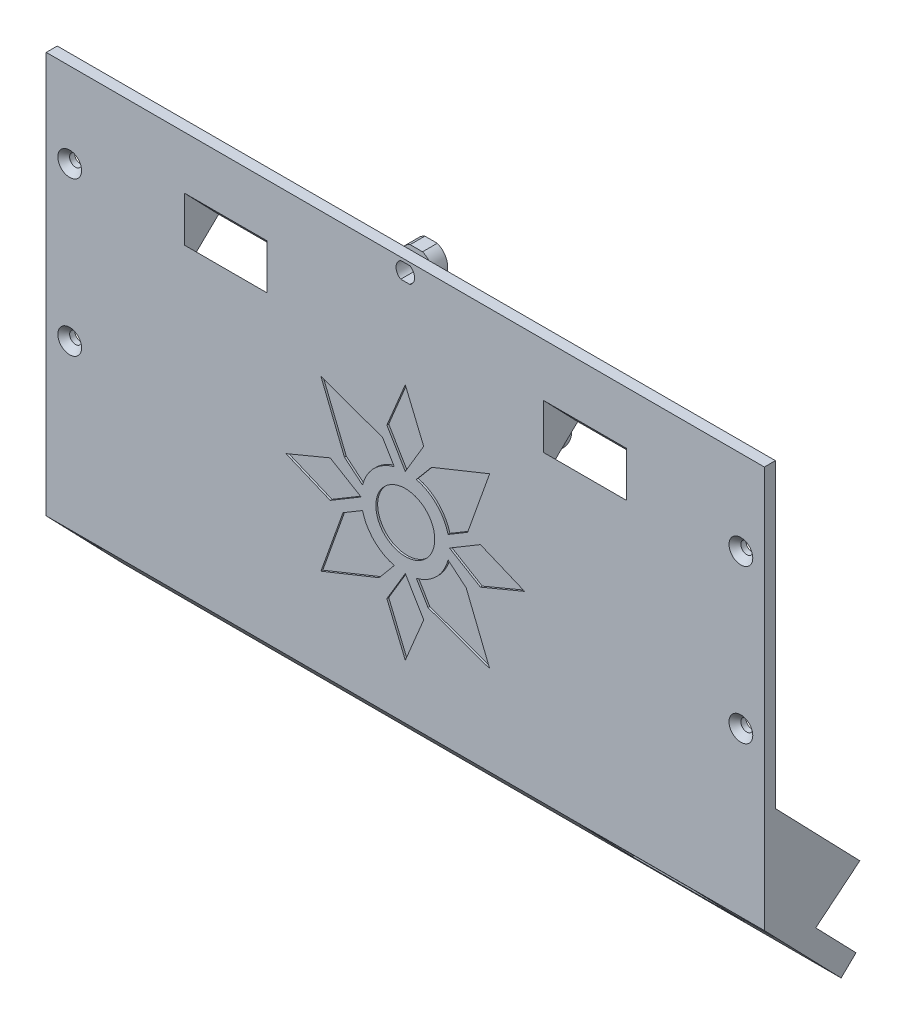
from build123d import *

# Parameters (mm, degrees)
CROQUIS1_W                  = 195
CROQUIS1_H                  = 38
CROQUIS1_R                  = 1.625
SALIENTE_EXTRUIR1_DEPTH     = 3
CROQUIS8_W                  = 195
CROQUIS8_H                  = 3
SALIENTE_EXTRUIR5_DEPTH     = 5
CROQUIS9_W                  = 195
CROQUIS9_H                  = 3
SALIENTE_EXTRUIR6_DEPTH     = 5
SALIENTE_EXTRUIR7_START     = -35
SALIENTE_EXTRUIR7_DEPTH     = 35
CORTAR_EXTRUIR4_DEPTH       = 106.247150057
CORTAR_EXTRUIR4_DEPTH_BACK  = 106.247150057
CROQUIS11_W                 = 22.5
CROQUIS11_H                 = 8.5
CORTAR_EXTRUIR5_REACH       = 168.011
CROQUIS13_R                 = 1
CORTAR_EXTRUIR6_DEPTH       = 5
SALIENTE_EXTRUIR8_START     = -35
SALIENTE_EXTRUIR8_DEPTH     = 35
CORTAR_EXTRUIR7_DEPTH       = 105.093743192
CORTAR_EXTRUIR7_DEPTH_BACK  = 105.093743192
CROQUIS16_W                 = 22.5
CROQUIS16_H                 = 8.5
CROQUIS17_R                 = 1
CORTAR_EXTRUIR8_DEPTH       = 5
CROQUIS18_R                 = 1.625
CORTAR_EXTRUIR9_DEPTH       = 10
CROQUIS19_W                 = 195
CROQUIS19_H                 = 24
SALIENTE_EXTRUIR9_DEPTH     = 3
CROQUIS20_W                 = 195
CROQUIS20_H                 = 28.69
SALIENTE_EXTRUIR10_DEPTH    = 3
CROQUIS22_W                 = 195
CROQUIS22_H                 = 8.799275258
CROQUIS22_W_2               = 10.817472397
CROQUIS22_H_2               = 9.408992843
CROQUIS22_W_3               = 11.057059306
SALIENTE_EXTRUIR11_DEPTH    = 3
CROQUIS23_R                 = 1.625
CORTAR_EXTRUIR10_DEPTH      = 10
CORTAR_EXTRUIR11_DEPTH      = 202.885550157
CORTAR_EXTRUIR11_DEPTH_BACK = 202.885550157
CROQUIS25_W                 = 6.04831912
CROQUIS25_H                 = 14.575165693
SALIENTE_EXTRUIR15_DEPTH    = 12.75
SALIENTE_EXTRUIR16_DEPTH    = 12.75
CROQUIS27_W                 = 3
CROQUIS27_H                 = 30
SALIENTE_EXTRUIR13_DEPTH    = 195
SALIENTE_EXTRUIR14_DEPTH    = 195
CORTAR_EXTRUIR12_DEPTH      = 124.960633848
CORTAR_EXTRUIR12_DEPTH_BACK = 124.960633848
CROQUIS31_R                 = 1.625
SALIENTE_EXTRUIR17_DEPTH    = 12.75
SALIENTE_EXTRUIR18_DEPTH    = 12.75
CORTAR_EXTRUIR15_DEPTH      = 124.840994831
CORTAR_EXTRUIR15_DEPTH_BACK = 124.840994831
CROQUIS39_R                 = 1.625
CORTAR_EXTRUIR16_START      = -4
CROQUIS40_R                 = 4
CORTAR_EXTRUIR16_DEPTH      = 120.840994831
SALIENTE_EXTRUIR19_START    = -15
SALIENTE_EXTRUIR19_DEPTH    = 4
CHAFL_N1_SIZE               = 10
SALIENTE_EXTRUIR20_DEPTH    = 3
CORTAR_EXTRUIR17_REACH      = 142.318
CROQUIS47_W                 = 25
CROQUIS47_H                 = 15
CORTAR_EXTRUIR18_REACH      = 131.667
CROQUIS49_R                 = 8
CORTAR_EXTRUIR19_DEPTH      = 0.5
CHAFL_N2_SIZE               = 3
SALIENTE_EXTRUIR22_DEPTH    = 4
CHAFL_N3_SIZE               = 1.6
SALIENTE_EXTRUIR23_START    = 2
CROQUIS52_R                 = 3
CROQUIS52_R_2               = 1
SALIENTE_EXTRUIR23_DEPTH    = 2


with BuildPart() as part:
    # Croquis1 → Saliente-Extruir1 (new body)
    with BuildSketch(Plane.XY):
        with Locations((0, 19)):
            Rectangle(CROQUIS1_W, CROQUIS1_H)
        with Locations((91.125, 15)):
            Circle(CROQUIS1_R, mode=Mode.SUBTRACT)
        with Locations(Location((-91.125, 15, 0), (0, 0, 180))):
            Circle(CROQUIS1_R, mode=Mode.SUBTRACT)
    extrude(amount=SALIENTE_EXTRUIR1_DEPTH)

    # Croquis8 → Saliente-Extruir5 (add)
    with BuildSketch(Plane.XZ):
        with Locations((0, 1.5)):
            Rectangle(CROQUIS8_W, CROQUIS8_H)
    extrude(amount=SALIENTE_EXTRUIR5_DEPTH)

    # Croquis9 → Saliente-Extruir6 (add)
    with BuildSketch(Plane(origin=(0, 38, 0), x_dir=(1, 0, 0), z_dir=(0, 1, 0))):
        with Locations((0, -1.5)):
            Rectangle(CROQUIS9_W, CROQUIS9_H)
    extrude(amount=SALIENTE_EXTRUIR6_DEPTH)

    # Croquis10 → Saliente-Extruir7 (add)
    with BuildSketch(Plane(origin=(97.5, 0, 0), x_dir=(0, 0, -1), z_dir=(1, 0, 0)).offset(SALIENTE_EXTRUIR7_START)):
        Polygon((0, 35.802217302), (10.516760097, 24.911793418), (1.165342693, 15.881234602), (0, 14.755876245), align=None)
    extrude(amount=-SALIENTE_EXTRUIR7_DEPTH)

    # Croquis11 → Cortar-Extruir4 (cut, two sides: drawn at the far end of the back side and taken through both)
    with BuildSketch(Plane(origin=(0, 7.63542445, 7.373443682), x_dir=(1, 0, 0), z_dir=(0, -0.7193398003386503, -0.6946583704589981)).offset(-CORTAR_EXTRUIR4_DEPTH_BACK)):
        with Locations((48.75, -19.62030993)):
            Rectangle(CROQUIS11_W, CROQUIS11_H)
    extrude(amount=CORTAR_EXTRUIR4_DEPTH + CORTAR_EXTRUIR4_DEPTH_BACK, mode=Mode.SUBTRACT)

    # Croquis12 → Cortar-Extruir5 (cut, up to next)
    with BuildSketch(Plane(origin=(62.5, 0, 0), x_dir=(0, 0, -1), z_dir=(1, 0, 0)), mode=Mode.PRIVATE) as cortar_extruir5_sk1:
        Polygon((10.516760097, 24.911793418), (0, 14.755876245), (0, 21.7066942), (7.043468245, 28.50849242), align=None)
    cortar_extruir5_tool1 = extrude(cortar_extruir5_sk1.sketch, amount=-CORTAR_EXTRUIR5_REACH, mode=Mode.PRIVATE) & part.part
    add(cortar_extruir5_tool1.solids().sort_by_distance((62.5, 22.296862, -4.447307))[0], mode=Mode.SUBTRACT)

    # Croquis13 → Cortar-Extruir6 (cut)
    with BuildSketch(Plane(origin=(0, 11.232123451, 10.846735534), x_dir=(1, 0, 0), z_dir=(0, -0.7193398003386495, -0.694658370458999))):
        with Locations(Location((33.75, -19.71030993, 0), (0, 0, 270))):
            Circle(CROQUIS13_R)
    extrude(amount=-CORTAR_EXTRUIR6_DEPTH, mode=Mode.SUBTRACT)

    # Croquis14 → Saliente-Extruir8 (add)
    with BuildSketch(Plane.ZY.offset(97.5).offset(SALIENTE_EXTRUIR8_START)):
        Polygon((0, 21.7066942), (-7.043468245, 28.50849242), (0, 35.802217302), align=None)
    extrude(amount=-SALIENTE_EXTRUIR8_DEPTH)

    # Croquis16 → Cortar-Extruir7 (cut, two sides: drawn at the far end of the back side and taken through both)
    with BuildSketch(Plane(origin=(0, 11.232123451, 10.846735534), x_dir=(1, 0, 0), z_dir=(0, -0.7193398003386495, -0.694658370458999)).offset(-CORTAR_EXTRUIR7_DEPTH_BACK)):
        with Locations((-48.75, -19.62030993)):
            Rectangle(CROQUIS16_W, CROQUIS16_H)
    extrude(amount=CORTAR_EXTRUIR7_DEPTH + CORTAR_EXTRUIR7_DEPTH_BACK, mode=Mode.SUBTRACT)

    # Croquis17 → Cortar-Extruir8 (cut)
    with BuildSketch(Plane(origin=(0, 11.232123451, 10.846735534), x_dir=(1, 0, 0), z_dir=(0, -0.7193398003386495, -0.694658370458999))):
        with Locations(Location((-33.75, -19.71030993, 0), (0, 0, 90))):
            Circle(CROQUIS17_R)
    extrude(amount=-CORTAR_EXTRUIR8_DEPTH, mode=Mode.SUBTRACT)

    # Croquis18 → Cortar-Extruir9 (cut)
    with BuildSketch(Plane.XY.offset(3)):
        with Locations((91.125, 23)):
            Circle(CROQUIS18_R)
        with Locations((-91.125, 23)):
            Circle(CROQUIS18_R)
    extrude(amount=-CORTAR_EXTRUIR9_DEPTH, mode=Mode.SUBTRACT)

    # Croquis19 → Saliente-Extruir9 (add)
    with BuildSketch(Plane.XY.offset(3)):
        with Locations((0, 7)):
            Rectangle(CROQUIS19_W, CROQUIS19_H)
    extrude(amount=-SALIENTE_EXTRUIR9_DEPTH)

    # Croquis20 → Saliente-Extruir10 (add)
    with BuildSketch(Plane.XY.offset(3)):
        with Locations((0, -19.345)):
            Rectangle(CROQUIS20_W, CROQUIS20_H)
    extrude(amount=-SALIENTE_EXTRUIR10_DEPTH)

    # Croquis22 → Saliente-Extruir11 (add)
    with BuildSketch(Plane.XY.offset(3)):
        with Locations((0, 47.399637629)):
            Rectangle(CROQUIS22_W, CROQUIS22_H)
        with Locations((-92.091263802, 22.840486177)):
            Rectangle(CROQUIS22_W_2, CROQUIS22_H_2)
        with Locations((91.971470347, 22.840486177)):
            Rectangle(CROQUIS22_W_3, CROQUIS22_H_2)
    extrude(amount=-SALIENTE_EXTRUIR11_DEPTH)

    # Croquis23 → Cortar-Extruir10 (cut)
    with BuildSketch(Plane.XY.offset(3)):
        with Locations((-91.125, 28.799275258)):
            Circle(CROQUIS23_R)
        with Locations((-91.125, -12.890724742)):
            Circle(CROQUIS23_R)
        with Locations((91.125, -12.890724742)):
            Circle(CROQUIS23_R)
        with Locations((91.125, 28.799275258)):
            Circle(CROQUIS23_R)
    extrude(amount=-CORTAR_EXTRUIR10_DEPTH, mode=Mode.SUBTRACT)

    # Croquis25 → Cortar-Extruir11 (cut, two sides: drawn at the far end of the back side and taken through both)
    with BuildSketch(Plane.ZY.offset(97.5).offset(-CORTAR_EXTRUIR11_DEPTH_BACK)):
        with Locations((3.02415956, -34.488307588)):
            Rectangle(CROQUIS25_W, CROQUIS25_H)
    extrude(amount=CORTAR_EXTRUIR11_DEPTH + CORTAR_EXTRUIR11_DEPTH_BACK, mode=Mode.SUBTRACT)

    # Croquis29 → Saliente-Extruir15 (add)
    with BuildSketch(Plane(origin=(97.5, 0, 0), x_dir=(0, 0, -1), z_dir=(1, 0, 0))):
        Polygon((-3, -27.200724742), (22.760693721, -53.876703995), (22.905942566, -53.736438816), (-2.854751155, -27.060459563), align=None)
    extrude(amount=-SALIENTE_EXTRUIR15_DEPTH)

    # Croquis30 → Saliente-Extruir16 (add)
    with BuildSketch(Plane.ZY.offset(97.5)):
        Polygon((0, -27.200724742), (3, -27.200724742), (-22.760693721, -53.876703995), (-22.905942566, -53.736438816), align=None)
    extrude(amount=-SALIENTE_EXTRUIR16_DEPTH)

    # Croquis27 → Saliente-Extruir13 (add)
    with BuildSketch(Plane(origin=(97.5, 0, 0), x_dir=(0, 0, -1), z_dir=(1, 0, 0))):
        with Locations((-1.5, -42.200724742)):
            Rectangle(CROQUIS27_W, CROQUIS27_H)
    extrude(amount=-SALIENTE_EXTRUIR13_DEPTH)

    # Croquis28 → Saliente-Extruir14 (add)
    with BuildSketch(Plane(origin=(97.5, 0, 0), x_dir=(0, 0, -1), z_dir=(1, 0, 0))):
        Polygon((21.890577426, -74.869081254), (0, -52.200724742), (0, -57.200724742), (-3, -57.200724742), (17.839751114, -78.780918752), align=None)
        Polygon((0, -57.200724742), (0, -52.200724742), (-3, -55.097791067), (-3, -57.200724742), align=None)
    extrude(amount=-SALIENTE_EXTRUIR14_DEPTH)

    # Croquis31 → Cortar-Extruir12 (cut, two sides: drawn at the far end of the back side and taken through both)
    with BuildSketch(Plane(origin=(0, -14.62480281, 15.144426643), x_dir=(1, 0, 0), z_dir=(0, -0.694658370458999, 0.7193398003386496)).offset(-CORTAR_EXTRUIR12_DEPTH_BACK)):
        with Locations(Location((91.125, -45.042164488, 0), (0, 0, 270))):
            Circle(CROQUIS31_R)
        with Locations(Location((-91.125, -45.042164488, 0), (0, 0, 270))):
            Circle(CROQUIS31_R)
    extrude(amount=CORTAR_EXTRUIR12_DEPTH + CORTAR_EXTRUIR12_DEPTH_BACK, mode=Mode.SUBTRACT)

    # Croquis32 → Saliente-Extruir17 (add)
    with BuildSketch(Plane(origin=(97.5, 0, 0), x_dir=(0, 0, -1), z_dir=(1, 0, 0))):
        Polygon((0, -30.307315684), (22.760693721, -53.876703995), (10.945288713, -63.534902998), (0, -52.200724742), align=None)
    extrude(amount=-SALIENTE_EXTRUIR17_DEPTH)

    # Croquis33 → Saliente-Extruir18 (add)
    with BuildSketch(Plane.ZY.offset(97.5)):
        Polygon((0, -30.307315684), (0, -52.200724742), (-10.945288713, -63.534902998), (-22.760693721, -53.876703995), align=None)
    extrude(amount=-SALIENTE_EXTRUIR18_DEPTH)

    # Croquis39 → Cortar-Extruir15 (cut, two sides: drawn at the far end of the back side and taken through both)
    with BuildSketch(Plane(origin=(0, -14.484537631, 14.999177798), x_dir=(-1, 0, 0), z_dir=(0, 0.6946583704589991, -0.7193398003386495)).offset(-CORTAR_EXTRUIR15_DEPTH_BACK)):
        with Locations(Location((91.125, -45.042164488, 0), (0, 0, 270))):
            Circle(CROQUIS39_R)
        with Locations(Location((-91.125, -45.042164488, 0), (0, 0, 270))):
            Circle(CROQUIS39_R)
    extrude(amount=CORTAR_EXTRUIR15_DEPTH + CORTAR_EXTRUIR15_DEPTH_BACK, mode=Mode.SUBTRACT)

    # Croquis40 → Cortar-Extruir16 (cut, through all)
    with BuildSketch(Plane(origin=(0, -14.484537631, 14.999177798), x_dir=(-1, 0, 0), z_dir=(0, 0.6946583704589991, -0.7193398003386495)).offset(CORTAR_EXTRUIR16_START)):
        with Locations(Location((-91.125, -45.042164488, 0), (0, 0, 90))):
            Circle(CROQUIS40_R)
        with Locations(Location((91.125, -45.042164488, 0), (0, 0, 90))):
            Circle(CROQUIS40_R)
    extrude(amount=-CORTAR_EXTRUIR16_DEPTH, mode=Mode.SUBTRACT)

    # Croquis43 → Saliente-Extruir19 (add)
    with BuildSketch(Plane(origin=(0, -49.679608393, -47.975040162), x_dir=(1, 0, 0), z_dir=(0, -0.7193398003386499, -0.6946583704589987)).offset(SALIENTE_EXTRUIR19_START)):
        with BuildLine():
            Line((-10, 36.261670386), (10, 36.261670386))
            Line((10, 36.261670386), (10, 26.261670386))
            Line((10, 26.261670386), (3.75, 26.261670386))
            Line((3.75, 26.261670386), (3.75, 31.261670386))
            ThreePointArc((3.75, 31.261670386), (0, 35.011670386), (-3.75, 31.261670386))
            Line((-3.75, 31.261670386), (-3.75, 26.261670386))
            Line((-3.75, 26.261670386), (-10, 26.261670386))
            Line((-10, 26.261670386), (-10, 36.261670386))
        make_face()
    extrude(amount=-SALIENTE_EXTRUIR19_DEPTH)

    # Chaflán1
    chafl_n1_edges = [part.edges().sort_by_distance(p)[0] for p in [
        (-10, -62.640304648, -10.081385129),
        (10, -62.640304648, -10.081385129),
    ]]
    chamfer(chafl_n1_edges, length=CHAFL_N1_SIZE - 0.0001)  # a hair under: the kernel refuses the full size

    # Croquis44 → Saliente-Extruir20 (add)
    with BuildSketch(Plane.ZY.offset(97.5)):
        Polygon((-30.180728616, -62.025319097), (-19.473022927, -72.365630285), (-10.945288713, -63.534902998), (-22.905942566, -53.736438816), align=None)
    extrude(amount=-SALIENTE_EXTRUIR20_DEPTH)

    # Croquis47 → Cortar-Extruir17 (cut, up to next)
    with BuildSketch(Plane(origin=(0, -29.101310359, 30.135289048), x_dir=(1, 0, 0), z_dir=(0, -0.6946583704589991, 0.7193398003386494)), mode=Mode.PRIVATE) as cortar_extruir17_sk1:
        with Locations((61.232763252, -51.562782804)):
            Rectangle(CROQUIS47_W, CROQUIS47_H)
    cortar_extruir17_tool1 = extrude(cortar_extruir17_sk1.sketch, amount=-CORTAR_EXTRUIR17_REACH, mode=Mode.PRIVATE) & part.part
    add(cortar_extruir17_tool1.solids().sort_by_distance((61.232763, -66.192472, -5.68323))[0], mode=Mode.SUBTRACT)

    # Croquis48 → Cortar-Extruir18 (cut, up to next)
    with BuildSketch(Plane.XY.offset(3), mode=Mode.PRIVATE) as cortar_extruir18_sk1:
        with BuildLine():
            Line((1.239203373, 50.999275258), (-1.239203373, 50.999275258))
            ThreePointArc((-1.239203373, 50.999275258), (-2.431884027, 49.478661068), (-2.2, 47.560071885))
            ThreePointArc((-2.2, 47.560071885), (-1.785444622, 47.013830635), (-1.239203373, 46.599275258))
            Line((-1.239203373, 46.599275258), (1.239203373, 46.599275258))
            ThreePointArc((1.239203373, 46.599275258), (2.525, 48.799275258), (1.239203373, 50.999275258))
        make_face()
    cortar_extruir18_tool1 = extrude(cortar_extruir18_sk1.sketch, amount=-CORTAR_EXTRUIR18_REACH, mode=Mode.PRIVATE) & part.part
    add(cortar_extruir18_tool1.solids().sort_by_distance((0, 48.799275, 3))[0], mode=Mode.SUBTRACT)

    # Croquis49 → Cortar-Extruir19 (cut)
    with BuildSketch(Plane.XY.offset(3)):
        with BuildLine():
            ThreePointArc((-11.618950039, -7), (-8.485281374, -1.514718626), (-3, 1.618950039))
            Line((-3, 1.618950039), (-6.154064033, 6.9153036))
            Line((-6.154064033, 6.9153036), (-22.907486476, 12.907486476))
            Line((-22.907486476, 12.907486476), (-16.537602787, -2.893123467))
            Line((-16.537602787, -2.893123467), (-11.618950039, -7))
        make_face()
        Polygon((0, 2), (-5, 10.396078054), (0, 22.396078054), (5, 10.396078054), align=None)
        with BuildLine():
            Line((7.106876533, 6.537602787), (3, 1.618950039))
            ThreePointArc((3, 1.618950039), (8.485281374, -1.514718626), (11.618950039, -7))
            Line((11.618950039, -7), (16.9153036, -3.845935967))
            Line((16.9153036, -3.845935967), (22.907486476, 12.907486476))
            Line((22.907486476, 12.907486476), (7.106876533, 6.537602787))
        make_face()
        Polygon((12, -10), (20.396078054, -15), (32.396078054, -10), (20.396078054, -5), align=None)
        with BuildLine():
            Line((16.537602787, -17.106876533), (11.618950039, -13))
            ThreePointArc((11.618950039, -13), (8.485281374, -18.485281374), (3, -21.618950039))
            Line((3, -21.618950039), (6.154064033, -26.9153036))
            Line((6.154064033, -26.9153036), (22.907486476, -32.907486476))
            Line((22.907486476, -32.907486476), (16.537602787, -17.106876533))
        make_face()
        with Locations((0, -10)):
            Circle(CROQUIS49_R)
        Polygon((0, -22), (-5, -30.396078054), (0, -42.396078054), (5, -30.396078054), align=None)
        with BuildLine():
            ThreePointArc((-3, -21.618950039), (-8.485281374, -18.485281374), (-11.618950039, -13))
            Line((-11.618950039, -13), (-16.9153036, -16.154064033))
            Line((-16.9153036, -16.154064033), (-22.907486476, -32.907486476))
            Line((-22.907486476, -32.907486476), (-7.106876533, -26.537602787))
            Line((-7.106876533, -26.537602787), (-3, -21.618950039))
        make_face()
        Polygon((-12, -10), (-20.396078054, -5), (-32.396078054, -10), (-20.396078054, -15), align=None)
    extrude(amount=-CORTAR_EXTRUIR19_DEPTH, mode=Mode.SUBTRACT)

    # Chaflán2
    chafl_n2_edges = [part.edges().sort_by_distance(p)[0] for p in [
        (48.732763252, -66.192472247, -5.683229631),
        (61.232763252, -71.587520749, -10.893167409),
        (73.732763252, -66.192472247, -5.683229631),
        (61.232763252, -60.797423744, -0.473291852),
    ]]
    chamfer(chafl_n2_edges, length=CHAFL_N2_SIZE)

    # Croquis51 → Saliente-Extruir22 (add)
    with BuildSketch(Plane(origin=(0, 0, 0), x_dir=(-1, 0, 0), z_dir=(0, 0, -1))):
        with BuildLine():
            Line((-1.683931412, 44.599275258), (1.683931412, 44.599275258))
            ThreePointArc((1.683931412, 44.599275258), (4.525, 48.799275258), (1.683931412, 52.999275258))
            Line((1.683931412, 52.999275258), (-1.683931412, 52.999275258))
            ThreePointArc((-1.683931412, 52.999275258), (-4.525, 48.799275258), (-1.683931412, 44.599275258))
        make_face()
        with BuildLine():
            Line((-1.239203373, 46.599275258), (1.239203373, 46.599275258))
            ThreePointArc((1.239203373, 46.599275258), (2.525, 48.799275258), (1.239203373, 50.999275258))
            Line((1.239203373, 50.999275258), (-1.239203373, 50.999275258))
            ThreePointArc((-1.239203373, 50.999275258), (-2.525, 48.799275258), (-1.239203373, 46.599275258))
        make_face(mode=Mode.SUBTRACT)
    extrude(amount=SALIENTE_EXTRUIR22_DEPTH)

    # Chaflán3
    chafl_n3_edges = [part.edges().sort_by_distance(p)[0] for p in [
        (89.5, 28.799275258, 3),
        (89.5, -12.890724742, 3),
        (-92.75, -12.890724742, 3),
        (-92.75, 28.799275258, 3),
    ]]
    chamfer(chafl_n3_edges, length=CHAFL_N3_SIZE)

    # Croquis52 → Saliente-Extruir23 (add)
    # profile 1 of 2: a face of its own
    with BuildSketch(Plane(origin=(0, 11.232123451, 10.846735534), x_dir=(1, 0, 0), z_dir=(0, -0.7193398003386494, -0.694658370458999)).offset(SALIENTE_EXTRUIR23_START)):
        with Locations(Location((33.75, -19.71030993, 0), (0, 0, 90))):
            Circle(CROQUIS52_R)
        with Locations(Location((33.75, -19.71030993, 0), (0, 0, 270))):
            Circle(CROQUIS52_R_2, mode=Mode.SUBTRACT)
    # profile 2 of 2: a face of its own
    with BuildSketch(Plane(origin=(0, 11.232123451, 10.846735534), x_dir=(1, 0, 0), z_dir=(0, -0.7193398003386494, -0.694658370458999)).offset(SALIENTE_EXTRUIR23_START)):
        with Locations(Location((-33.75, -19.71030993, 0), (0, 0, 90))):
            Circle(CROQUIS52_R)
        with Locations(Location((-33.75, -19.71030993, 0), (0, 0, 90))):
            Circle(CROQUIS52_R_2, mode=Mode.SUBTRACT)
    extrude(amount=-SALIENTE_EXTRUIR23_DEPTH)


solid = part.part
